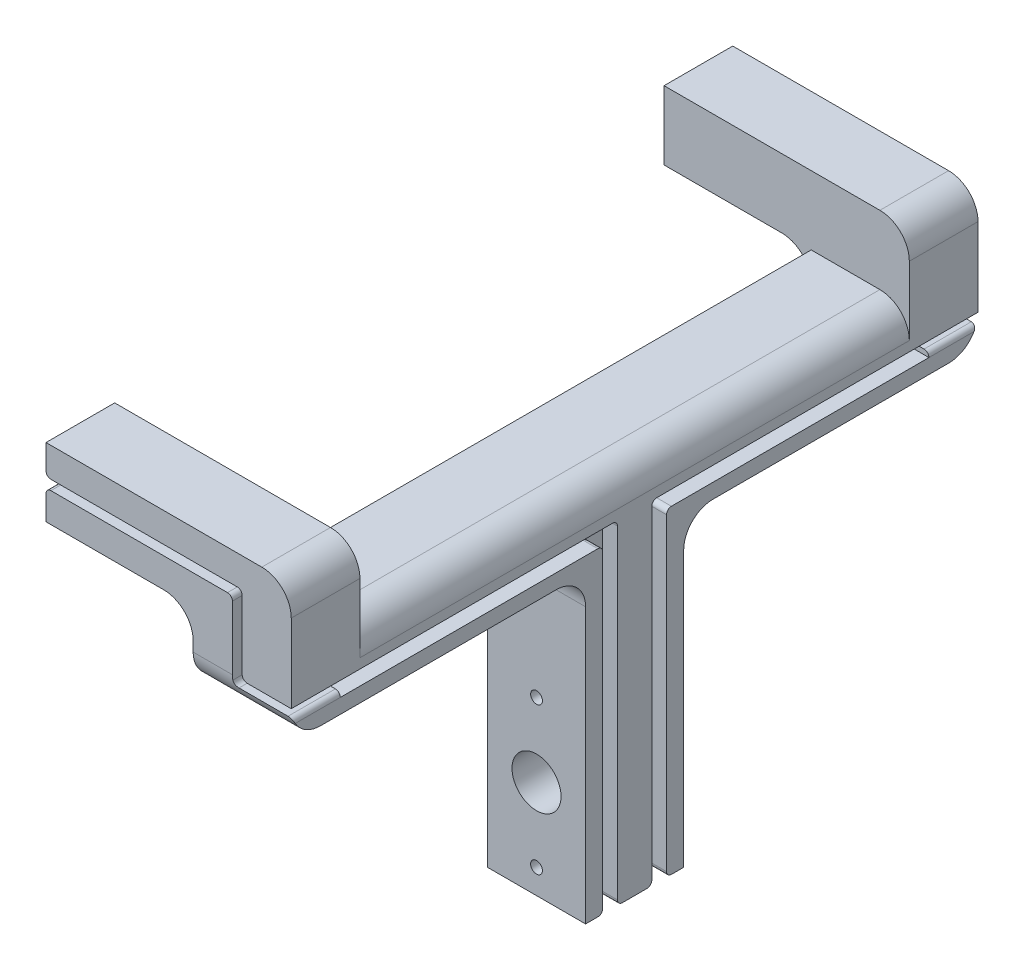
from build123d import *

# Parameters (mm, degrees)
ESQUISSE1_W             = 10
ESQUISSE1_H             = 38
ESQUISSE1_R             = 2.5
ESQUISSE1_R_2           = 0.5
BOSS_EXTRU_1_DEPTH      = 10
BOSS_EXTRU_2_DEPTH      = 10
ESQUISSE5_W             = 7
ESQUISSE5_H             = 7
BOSS_EXTRU_3_DEPTH      = 15
CONG_1_R                = 3
D_GAGEMENT_M11_D        = 1.2
ENL_V_MAT_EXTRU_2_DEPTH = 5
ENL_V_MAT_EXTRU_3_DEPTH = 1.5
CONG_2_R                = 0.5


with BuildPart() as part:
    # Esquisse1 → Boss.-Extru.1 (new body)
    with BuildSketch(Plane.XY):
        with Locations((9, 19)):
            Rectangle(ESQUISSE1_W, ESQUISSE1_H)
        with Locations((9, 10)):
            Circle(ESQUISSE1_R, mode=Mode.SUBTRACT)
        with Locations((9, 17.5)):
            Circle(ESQUISSE1_R_2, mode=Mode.SUBTRACT)
        with Locations((9, 2.5)):
            Circle(ESQUISSE1_R_2, mode=Mode.SUBTRACT)
    extrude(amount=BOSS_EXTRU_1_DEPTH)

    # Esquisse4 → Boss.-Extru.2 (add)
    with BuildSketch(Plane(origin=(14, 0, 0), x_dir=(0, 0, -1), z_dir=(1, 0, 0))):
        Polygon((-33, 38), (23, 38), (23, 45), (30, 45), (30, 31), (-40, 31), (-40, 45), (-33, 45), align=None)
    extrude(amount=-BOSS_EXTRU_2_DEPTH)

    # Esquisse5 → Boss.-Extru.3 (add)
    with BuildSketch(Plane.ZY.offset(-4)):
        with Locations((-26.5, 41.5)):
            Rectangle(ESQUISSE5_W, ESQUISSE5_H)
        with Locations((36.5, 41.5)):
            Rectangle(ESQUISSE5_W, ESQUISSE5_H)
    extrude(amount=BOSS_EXTRU_3_DEPTH)

    # Congé1
    cong_1_edges = [part.edges().sort_by_distance(p)[0] for p in [
        (4, 38, -26.5),
        (4, 38, 36.5),
        (9, 31, -30),
        (9, 31, 40),
        (14, 45, -26.5),
        (14, 45, 36.5),
        (9, 31, 0),
        (9, 31, 10),
        (14, 38, 5),
    ]]
    fillet(cong_1_edges, radius=CONG_1_R)

    # Dégagement M11 (through all)
    with Locations(Plane.XY.offset(10)):
        with Locations((9, 17.5), (9, 2.5)):
            Hole(D_GAGEMENT_M11_D / 2)

    # Esquisse10 → Enlèv. mat.-Extru.2 (cut)
    with BuildSketch(Plane.XY.offset(40)):
        Polygon((-11, 41), (8, 41), (8, 33), (14, 33), (14, 34), (9, 34), (9, 42), (-11, 42), align=None)
    enl_v_mat_extru_2 = extrude(amount=-ENL_V_MAT_EXTRU_2_DEPTH, mode=Mode.SUBTRACT)

    # Esquisse11 → Enlèv. mat.-Extru.3 (cut)
    with BuildSketch(Plane(origin=(14, 0, 0), x_dir=(0, 0, -1), z_dir=(1, 0, 0))):
        Polygon((-35, 34), (-6.75, 34), (-6.75, 0), (-8.25, 0), (-8.25, 32.5), (-35, 32.5), align=None)
    enl_v_mat_extru_3 = extrude(amount=-ENL_V_MAT_EXTRU_3_DEPTH, mode=Mode.SUBTRACT)

    # Symétrie1: Enlèv. mat.-Extru.2, Enlèv. mat.-Extru.3 across plane
    add(enl_v_mat_extru_2.mirror(Plane.XY.offset(5)), mode=Mode.SUBTRACT)
    add(enl_v_mat_extru_3.mirror(Plane.XY.offset(5)), mode=Mode.SUBTRACT)

    # Congé2
    cong_2_edges = [part.edges().sort_by_distance(p)[0] for p in [
        (13.25, 0, 8.25),
        (12.5, 0, 7.5),
        (13.25, 0, 6.75),
        (13.25, 34, 6.75),
        (13.25, 32.5, 8.25),
        (-11, 41, 37.5),
        (-11, 42, 37.5),
        (14, 33, 37.414213562),
        (8, 33, 37.414213562),
        (9, 34, 37.5),
        (9, 42, 37.5),
        (8, 41, 37.5),
        (-11, 41.5, 35),
        (-11, 41, -27.5),
        (-11, 41.5, -25),
        (-11, 42, -27.5),
        (9, 42, -27.5),
        (8, 41, -27.5),
        (8, 33, -27.414213562),
        (9, 34, -27.5),
        (14, 33, -27.414213562),
        (13.25, 0, 1.75),
        (13.25, 0, 3.25),
        (12.5, 0, 2.5),
        (13.25, 32.5, 1.75),
        (13.25, 34, 3.25),
    ]]
    fillet(cong_2_edges, radius=CONG_2_R)


solid = part.part
